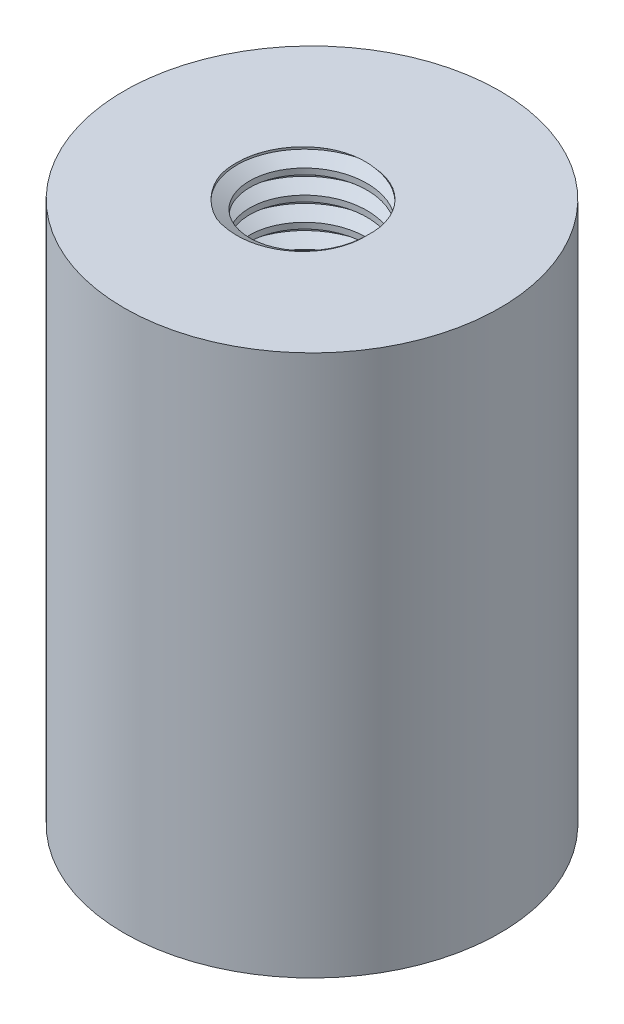
from build123d import *

# Parameters (mm, degrees)
SKETCH1_R           = 6.35
BOSS_EXTRUDE1_DEPTH = 18.288
SKETCH13_R          = 1.984375
CUT_EXTRUDE1_DEPTH  = 20.574
THREAD1_PITCH       = 0.79375


with BuildPart() as part:
    # Sketch1 → Boss-Extrude1 (new body)
    with BuildSketch(Plane(origin=(0, 0, 0), x_dir=(1, 0, 0), z_dir=(0, 1, 0))):
        with Locations(Location((0, 0, 0), (0, 0, 270))):
            Circle(SKETCH1_R)
    extrude(amount=BOSS_EXTRUDE1_DEPTH)

    # Sketch13 → Cut-Extrude1 (cut)
    with BuildSketch(Plane(origin=(0, 18.288, 0), x_dir=(1, 0, 0), z_dir=(0, 1, 0))):
        with Locations(Location((0, 0, 0), (0, 0, 270))):
            Circle(SKETCH13_R)
    extrude(amount=-CUT_EXTRUDE1_DEPTH, mode=Mode.SUBTRACT)

    # Thread1: the profile of Thread Profile3 profile screwed along a right-hand helix of 24.299843 turns, 8 arcs to a turn; built about Z, then put on its axis
    thread1_z = Axis((0, 0, 0), (0, 0, 1))
    thread1_corners = [(1.984075, 0, -0.000173205), (2.414004788, 0, 0.248046874), (2.414004788, 0, 0.347265624), (1.984075, 0, 0.595485703)]
    with BuildLine(mode=Mode.PRIVATE) as thread1_profile:
        Line(thread1_corners[0], thread1_corners[1])
        Line(thread1_corners[1], thread1_corners[2])
        Line(thread1_corners[2], thread1_corners[3])
        Line(thread1_corners[3], thread1_corners[0])
    thread1_cap = Face(thread1_profile.wire())
    thread1_turn_angles = [0, 22.5, 45, 67.5, 90, 112.5, 135, 157.5, 180, 202.5, 225, 247.5, 270, 292.5, 315, 337.5, 360]
    thread1_turn_weights = [1, 0.9238795325112867, 1, 0.9238795325112867, 1, 0.9238795325112867, 1, 0.9238795325112867, 1, 0.9238795325112867, 1, 0.9238795325112867, 1, 0.9238795325112867, 1, 0.9238795325112867, 1]
    thread1_turn_rails = [Edge.make_bspline([Vector(p[0], p[1], 0).rotate(thread1_z, thread1_turn_angles[k]) / thread1_turn_weights[k] + Vector(0, 0, p[2] + THREAD1_PITCH * thread1_turn_angles[k] / 360) for k in range(17)], [0, 0, 0, 1, 1, 2, 2, 3, 3, 4, 4, 5, 5, 6, 6, 7, 7, 8, 8, 8], 2, thread1_turn_weights) for p in thread1_corners]
    thread1_turn_sides = [Face.make_surface_from_curves(thread1_turn_rails[p[0]], thread1_turn_rails[p[1]]) for p in [(0, 1), (1, 2), (2, 3), (3, 0)]]
    thread1_last_angles = [8640, 8662.5, 8685, 8707.5, 8730, 8738.971653543, 8747.943307087]
    thread1_last_weights = [1, 0.9238795325112867, 1, 0.9238795325112867, 1, 0.9877656139462733, 1]
    thread1_last_rails = [Edge.make_bspline([Vector(p[0], p[1], 0).rotate(thread1_z, thread1_last_angles[k]) / thread1_last_weights[k] + Vector(0, 0, p[2] + THREAD1_PITCH * thread1_last_angles[k] / 360) for k in range(7)], [0, 0, 0, 1, 1, 2, 2, 3, 3, 3], 2, thread1_last_weights) for p in thread1_corners]
    thread1_last_sides = [Face.make_surface_from_curves(thread1_last_rails[p[0]], thread1_last_rails[p[1]]) for p in [(0, 1), (1, 2), (2, 3), (3, 0)]]
    thread1 = Plane(origin=(0, 19.288, 0), x_dir=(-1, 0, 0), z_dir=(0, -1, 0)) * Solid(Shell([*[p.moved(Location((0, 0, THREAD1_PITCH * i))) for i in range(24) for p in thread1_turn_sides], *thread1_last_sides, thread1_cap, thread1_cap.rotate(thread1_z, 8747.943307087).moved(Location((0, 0, THREAD1_PITCH * 8747.943307087 / 360)))]))
    add(thread1, mode=Mode.SUBTRACT)


solid = part.part
